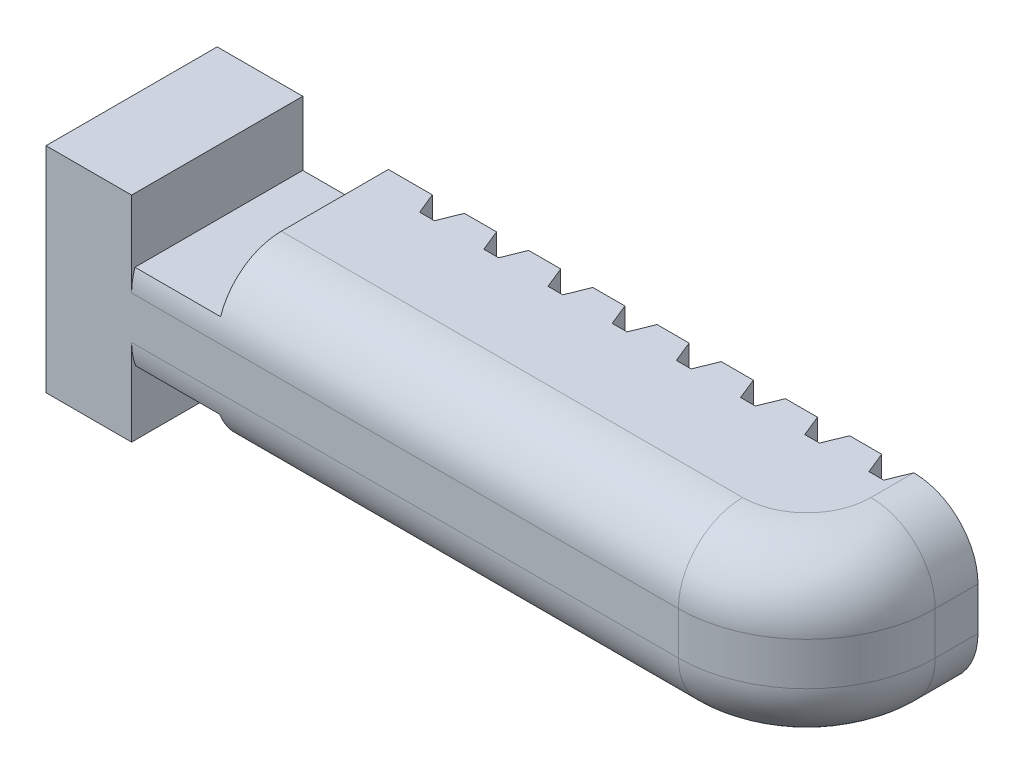
from build123d import *

# Parameters (mm, degrees)
BOSS_EXTRUDE1_DEPTH          = 40
FILLET1_R                    = 60
FILLET2_R                    = 30
SKETCH3_W                    = 15
SKETCH3_H                    = 109.922704731
CUT_EXTRUDE1_DEPTH           = 10
CUT_EXTRUDE1_DRAFT           = -22
CUT_EXTRUDE1_PROFILE_2_DEPTH = 10
CUT_EXTRUDE1_PROFILE_2_DRAFT = -22
CUT_EXTRUDE1_PROFILE_3_DEPTH = 10
CUT_EXTRUDE1_PROFILE_3_DRAFT = -22
CUT_EXTRUDE1_PROFILE_4_DEPTH = 10
CUT_EXTRUDE1_PROFILE_4_DRAFT = -22
CUT_EXTRUDE1_PROFILE_5_DEPTH = 10
CUT_EXTRUDE1_PROFILE_5_DRAFT = -22
CUT_EXTRUDE1_PROFILE_6_DEPTH = 10
CUT_EXTRUDE1_PROFILE_6_DRAFT = -22
CUT_EXTRUDE1_PROFILE_7_DEPTH = 10
CUT_EXTRUDE1_PROFILE_7_DRAFT = -22
CUT_EXTRUDE1_PROFILE_8_DEPTH = 10
CUT_EXTRUDE1_PROFILE_8_DRAFT = -22


with BuildPart() as part:
    # Sketch1 → Boss-Extrude1 (new, symmetric)
    with BuildSketch(Plane.XY):
        Polygon((0, 41.520471033), (0, -58.474576271), (40, -58.474576271), (40, -28.474576271), (79.370562847, -28.474576271), (79.370562847, -48.090018927), (355.561633386, -48.090018927), (355.561633386, -28.474576271), (355.561633386, 11.525423729), (355.561633386, 31.909981073), (80, 31.909981073), (80, 11.520471033), (40, 11.520471033), (40, 41.520471033), align=None)
    extrude(amount=BOSS_EXTRUDE1_DEPTH, both=True)

    # Fillet1
    fillet1_edges = [part.edges().sort_by_distance(p)[0] for p in [
        (355.561633386, -8.090018927, 40),
    ]]
    fillet(fillet1_edges, radius=FILLET1_R)

    # Fillet2
    # the kernel refuses this fillet: 30 mm, written as the material it takes off along each edge
    with BuildSketch(Plane(origin=(355.561633386, -48.090018927, -115), x_dir=(0, 1, 0), z_dir=(0, 0, 1)), Plane(origin=(355.561633386, 31.909981073, -115), x_dir=(-1, 0, 0), z_dir=(0, 0, 1))) as fillet2_piece_1:
        with BuildLine():
            CenterArc((FILLET2_R, FILLET2_R), FILLET2_R, 180, 90)
            Line((0, FILLET2_R), (0, 0))
            Line((0, 0), (FILLET2_R, 0))
        make_face()
    extrude(amount=95, mode=Mode.SUBTRACT)
    with BuildSketch(Plane(origin=(295.561633386, -48.090018927, -20), x_dir=(1, 0, 0), z_dir=(0, 0, -1))) as fillet2_piece_2:
        with BuildLine():
            CenterArc((60 - FILLET2_R, -FILLET2_R), FILLET2_R, 0, 90)
            Line((60 - FILLET2_R, 0), (60, 0))
            Line((60, 0), (60, -FILLET2_R))
        make_face()
    revolve(axis=Axis((295.561633386, -48.090018927, -20), (0, -1, 0)), revolution_arc=90, mode=Mode.SUBTRACT)
    with BuildSketch(Plane(origin=(295.561633386, 31.909981073, -20), x_dir=(1, 0, 0), z_dir=(0, 0, -1))) as fillet2_piece_3:
        with BuildLine():
            CenterArc((60 - FILLET2_R, FILLET2_R), FILLET2_R, 270, 90)
            Line((60, FILLET2_R), (60, 0))
            Line((60, 0), (60 - FILLET2_R, 0))
        make_face()
    revolve(axis=Axis((295.561633386, 31.909981073, -20), (0, -1, 0)), revolution_arc=90, mode=Mode.SUBTRACT)
    with BuildSketch(Plane(origin=(4.370562847, -48.090018927, 40), x_dir=(0, 1, 0), z_dir=(1, 0, 0))) as fillet2_piece_4_section:
        with BuildLine():
            CenterArc((FILLET2_R, -FILLET2_R), FILLET2_R, 90, 90)
            Line((0, -FILLET2_R), (0, 0))
            Line((0, 0), (FILLET2_R, 0))
        make_face()
    fillet2_piece_4 = extrude(amount=291.191070539, mode=Mode.PRIVATE)
    fillet2_piece_4 = split(fillet2_piece_4, bisect_by=Plane(origin=(40, -25.894757841, 39.446684124), z_dir=(1, 0, 0)), keep=Keep.TOP, mode=Mode.PRIVATE)
    add(fillet2_piece_4, mode=Mode.SUBTRACT)
    with BuildSketch(Plane(origin=(295.561633386, 31.909981073, 40), x_dir=(0, 0, -1), z_dir=(-1, 0, 0))) as fillet2_piece_5_section:
        with BuildLine():
            CenterArc((FILLET2_R, FILLET2_R), FILLET2_R, 180, 90)
            Line((0, FILLET2_R), (0, 0))
            Line((0, 0), (FILLET2_R, 0))
        make_face()
    fillet2_piece_5 = extrude(amount=290.561633386, mode=Mode.PRIVATE)
    fillet2_piece_5 = split(fillet2_piece_5, bisect_by=Plane(origin=(40, 26.935715602, 30.794780606), z_dir=(1, 0, 0)), keep=Keep.TOP, mode=Mode.PRIVATE)
    add(fillet2_piece_5, mode=Mode.SUBTRACT)


with BuildPart() as cut_extrude1_tool:
    # Sketch3 → Cut-Extrude1 (with draft: the straight prism first)
    with BuildSketch(Plane(origin=(0, 0, -40), x_dir=(-1, 0, 0), z_dir=(0, 0, -1))):
        with Locations((-318.061633386, -9.051561529)):
            Rectangle(SKETCH3_W, SKETCH3_H)
    extrude(amount=-CUT_EXTRUDE1_DEPTH)
    # Cut-Extrude1: the draft: its side faces are tilted about the plane it starts from
    cut_extrude1_sides = [cut_extrude1_tool.faces().sort_by_distance(p)[0] for p in [
        (325.561633386, -9.051561529, -35),
        (318.061633386, -64.012913894, -35),
        (310.561633386, -9.051561529, -35),
        (318.061633386, 45.909790837, -35),
    ]]
    draft(cut_extrude1_sides, Plane(origin=(0, 0, -40), x_dir=(-1, 0, 0), z_dir=(0, 0, -1)), CUT_EXTRUDE1_DRAFT)


with BuildPart() as part_1:
    add(part.part)

    # Cut-Extrude1: cut by cut_extrude1_tool
    add(cut_extrude1_tool.part, mode=Mode.SUBTRACT)


with BuildPart() as cut_extrude1_profile_2_tool:
    # Sketch3 → Cut-Extrude1 profile 2 (with draft: the straight prism first)
    with BuildSketch(Plane(origin=(0, 0, -40), x_dir=(-1, 0, 0), z_dir=(0, 0, -1))):
        with Locations((-288.061633386, -9.051561529)):
            Rectangle(SKETCH3_W, SKETCH3_H)
    extrude(amount=-CUT_EXTRUDE1_PROFILE_2_DEPTH)
    # Cut-Extrude1 profile 2: the draft: its side faces are tilted about the plane it starts from
    cut_extrude1_profile_2_sides = [cut_extrude1_profile_2_tool.faces().sort_by_distance(p)[0] for p in [
        (295.561633386, -9.051561529, -35),
        (288.061633386, -64.012913894, -35),
        (280.561633386, -9.051561529, -35),
        (288.061633386, 45.909790837, -35),
    ]]
    draft(cut_extrude1_profile_2_sides, Plane(origin=(0, 0, -40), x_dir=(-1, 0, 0), z_dir=(0, 0, -1)), CUT_EXTRUDE1_PROFILE_2_DRAFT)


with BuildPart() as part_2:
    add(part_1.part)

    # Cut-Extrude1 profile 2: cut by cut_extrude1_profile_2_tool
    add(cut_extrude1_profile_2_tool.part, mode=Mode.SUBTRACT)


with BuildPart() as cut_extrude1_profile_3_tool:
    # Sketch3 → Cut-Extrude1 profile 3 (with draft: the straight prism first)
    with BuildSketch(Plane(origin=(0, 0, -40), x_dir=(-1, 0, 0), z_dir=(0, 0, -1))):
        with Locations((-258.061633386, -9.051561529)):
            Rectangle(SKETCH3_W, SKETCH3_H)
    extrude(amount=-CUT_EXTRUDE1_PROFILE_3_DEPTH)
    # Cut-Extrude1 profile 3: the draft: its side faces are tilted about the plane it starts from
    cut_extrude1_profile_3_sides = [cut_extrude1_profile_3_tool.faces().sort_by_distance(p)[0] for p in [
        (265.561633386, -9.051561529, -35),
        (258.061633386, -64.012913894, -35),
        (250.561633386, -9.051561529, -35),
        (258.061633386, 45.909790837, -35),
    ]]
    draft(cut_extrude1_profile_3_sides, Plane(origin=(0, 0, -40), x_dir=(-1, 0, 0), z_dir=(0, 0, -1)), CUT_EXTRUDE1_PROFILE_3_DRAFT)


with BuildPart() as part_3:
    add(part_2.part)

    # Cut-Extrude1 profile 3: cut by cut_extrude1_profile_3_tool
    add(cut_extrude1_profile_3_tool.part, mode=Mode.SUBTRACT)


with BuildPart() as cut_extrude1_profile_4_tool:
    # Sketch3 → Cut-Extrude1 profile 4 (with draft: the straight prism first)
    with BuildSketch(Plane(origin=(0, 0, -40), x_dir=(-1, 0, 0), z_dir=(0, 0, -1))):
        with Locations((-228.061633386, -9.051561529)):
            Rectangle(SKETCH3_W, SKETCH3_H)
    extrude(amount=-CUT_EXTRUDE1_PROFILE_4_DEPTH)
    # Cut-Extrude1 profile 4: the draft: its side faces are tilted about the plane it starts from
    cut_extrude1_profile_4_sides = [cut_extrude1_profile_4_tool.faces().sort_by_distance(p)[0] for p in [
        (235.561633386, -9.051561529, -35),
        (228.061633386, -64.012913894, -35),
        (220.561633386, -9.051561529, -35),
        (228.061633386, 45.909790837, -35),
    ]]
    draft(cut_extrude1_profile_4_sides, Plane(origin=(0, 0, -40), x_dir=(-1, 0, 0), z_dir=(0, 0, -1)), CUT_EXTRUDE1_PROFILE_4_DRAFT)


with BuildPart() as part_4:
    add(part_3.part)

    # Cut-Extrude1 profile 4: cut by cut_extrude1_profile_4_tool
    add(cut_extrude1_profile_4_tool.part, mode=Mode.SUBTRACT)


with BuildPart() as cut_extrude1_profile_5_tool:
    # Sketch3 → Cut-Extrude1 profile 5 (with draft: the straight prism first)
    with BuildSketch(Plane(origin=(0, 0, -40), x_dir=(-1, 0, 0), z_dir=(0, 0, -1))):
        with Locations((-198.061633386, -9.051561529)):
            Rectangle(SKETCH3_W, SKETCH3_H)
    extrude(amount=-CUT_EXTRUDE1_PROFILE_5_DEPTH)
    # Cut-Extrude1 profile 5: the draft: its side faces are tilted about the plane it starts from
    cut_extrude1_profile_5_sides = [cut_extrude1_profile_5_tool.faces().sort_by_distance(p)[0] for p in [
        (205.561633386, -9.051561529, -35),
        (198.061633386, -64.012913894, -35),
        (190.561633386, -9.051561529, -35),
        (198.061633386, 45.909790837, -35),
    ]]
    draft(cut_extrude1_profile_5_sides, Plane(origin=(0, 0, -40), x_dir=(-1, 0, 0), z_dir=(0, 0, -1)), CUT_EXTRUDE1_PROFILE_5_DRAFT)


with BuildPart() as part_5:
    add(part_4.part)

    # Cut-Extrude1 profile 5: cut by cut_extrude1_profile_5_tool
    add(cut_extrude1_profile_5_tool.part, mode=Mode.SUBTRACT)


with BuildPart() as cut_extrude1_profile_6_tool:
    # Sketch3 → Cut-Extrude1 profile 6 (with draft: the straight prism first)
    with BuildSketch(Plane(origin=(0, 0, -40), x_dir=(-1, 0, 0), z_dir=(0, 0, -1))):
        with Locations((-168.061633386, -9.051561529)):
            Rectangle(SKETCH3_W, SKETCH3_H)
    extrude(amount=-CUT_EXTRUDE1_PROFILE_6_DEPTH)
    # Cut-Extrude1 profile 6: the draft: its side faces are tilted about the plane it starts from
    cut_extrude1_profile_6_sides = [cut_extrude1_profile_6_tool.faces().sort_by_distance(p)[0] for p in [
        (175.561633386, -9.051561529, -35),
        (168.061633386, -64.012913894, -35),
        (160.561633386, -9.051561529, -35),
        (168.061633386, 45.909790837, -35),
    ]]
    draft(cut_extrude1_profile_6_sides, Plane(origin=(0, 0, -40), x_dir=(-1, 0, 0), z_dir=(0, 0, -1)), CUT_EXTRUDE1_PROFILE_6_DRAFT)


with BuildPart() as part_6:
    add(part_5.part)

    # Cut-Extrude1 profile 6: cut by cut_extrude1_profile_6_tool
    add(cut_extrude1_profile_6_tool.part, mode=Mode.SUBTRACT)


with BuildPart() as cut_extrude1_profile_7_tool:
    # Sketch3 → Cut-Extrude1 profile 7 (with draft: the straight prism first)
    with BuildSketch(Plane(origin=(0, 0, -40), x_dir=(-1, 0, 0), z_dir=(0, 0, -1))):
        with Locations((-138.061633386, -9.051561529)):
            Rectangle(SKETCH3_W, SKETCH3_H)
    extrude(amount=-CUT_EXTRUDE1_PROFILE_7_DEPTH)
    # Cut-Extrude1 profile 7: the draft: its side faces are tilted about the plane it starts from
    cut_extrude1_profile_7_sides = [cut_extrude1_profile_7_tool.faces().sort_by_distance(p)[0] for p in [
        (145.561633386, -9.051561529, -35),
        (138.061633386, -64.012913894, -35),
        (130.561633386, -9.051561529, -35),
        (138.061633386, 45.909790837, -35),
    ]]
    draft(cut_extrude1_profile_7_sides, Plane(origin=(0, 0, -40), x_dir=(-1, 0, 0), z_dir=(0, 0, -1)), CUT_EXTRUDE1_PROFILE_7_DRAFT)


with BuildPart() as part_7:
    add(part_6.part)

    # Cut-Extrude1 profile 7: cut by cut_extrude1_profile_7_tool
    add(cut_extrude1_profile_7_tool.part, mode=Mode.SUBTRACT)


with BuildPart() as cut_extrude1_profile_8_tool:
    # Sketch3 → Cut-Extrude1 profile 8 (with draft: the straight prism first)
    with BuildSketch(Plane(origin=(0, 0, -40), x_dir=(-1, 0, 0), z_dir=(0, 0, -1))):
        with Locations((-108.061633386, -9.051561529)):
            Rectangle(SKETCH3_W, SKETCH3_H)
    extrude(amount=-CUT_EXTRUDE1_PROFILE_8_DEPTH)
    # Cut-Extrude1 profile 8: the draft: its side faces are tilted about the plane it starts from
    cut_extrude1_profile_8_sides = [cut_extrude1_profile_8_tool.faces().sort_by_distance(p)[0] for p in [
        (115.561633386, -9.051561529, -35),
        (108.061633386, -64.012913894, -35),
        (100.561633386, -9.051561529, -35),
        (108.061633386, 45.909790837, -35),
    ]]
    draft(cut_extrude1_profile_8_sides, Plane(origin=(0, 0, -40), x_dir=(-1, 0, 0), z_dir=(0, 0, -1)), CUT_EXTRUDE1_PROFILE_8_DRAFT)


with BuildPart() as part_8:
    add(part_7.part)

    # Cut-Extrude1 profile 8: cut by cut_extrude1_profile_8_tool
    add(cut_extrude1_profile_8_tool.part, mode=Mode.SUBTRACT)


solid = part_8.part
